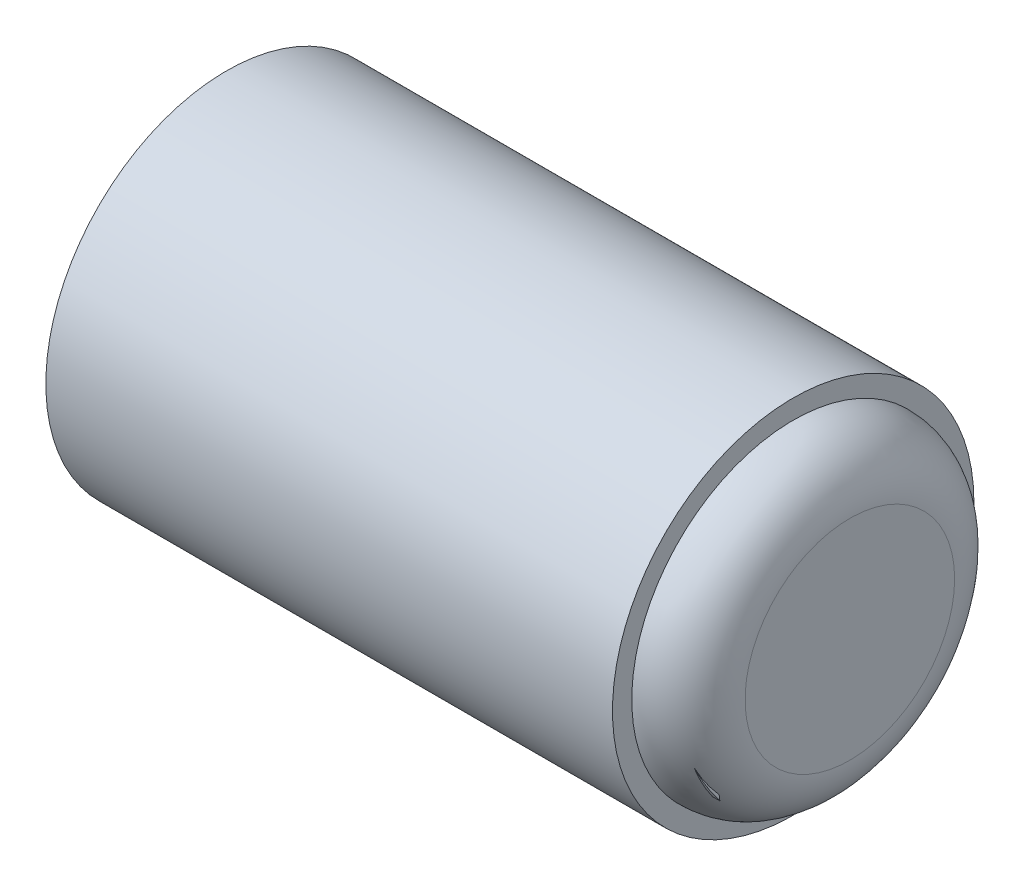
from build123d import *

# Parameters (mm, degrees)
SKETCH2_R           = 3.189369039
SKETCH2_R_2         = 2.589261351
BOSS_EXTRUDE1_DEPTH = 10
SKETCH3_R           = 2.849023425
BOSS_EXTRUDE2_DEPTH = 1
FILLET1_R           = 1
SWEEP1_PITCH        = 3


with BuildPart() as part:
    # Sketch2 → Boss-Extrude1 (new body)
    with BuildSketch(Plane(origin=(0, 0, 0), x_dir=(0, 0, -1), z_dir=(1, 0, 0))):
        Circle(SKETCH2_R)
        Circle(SKETCH2_R_2, mode=Mode.SUBTRACT)
    extrude(amount=BOSS_EXTRUDE1_DEPTH)

    # Sketch3 → Boss-Extrude2 (add)
    with BuildSketch(Plane(origin=(10, 0, 0), x_dir=(0, 0, -1), z_dir=(1, 0, 0))):
        Circle(SKETCH3_R)
    extrude(amount=BOSS_EXTRUDE2_DEPTH)

    # Fillet1
    fillet1_edges = [part.edges().sort_by_distance(p)[0] for p in [
        (11, 0, 2.849023425),
    ]]
    fillet(fillet1_edges, radius=FILLET1_R - 0.0001)  # a hair under: the kernel refuses the full size

    # Sweep1: the profile of Sketch7 profile screwed along a right-hand helix of 3.1 turns, 10 arcs to a turn; built about Z, then put on its axis
    sweep1_z = Axis((0, 0, 0), (0, 0, 1))
    sweep1_corners = [(2.589561351, 0, -0.0003), (2.589561351, 0, 1.5003), (2.289261351, 0, 1.2), (2.289261351, 0, 0.3)]
    with BuildLine(mode=Mode.PRIVATE) as sweep1_profile:
        Line(sweep1_corners[0], sweep1_corners[1])
        Line(sweep1_corners[1], sweep1_corners[2])
        Line(sweep1_corners[2], sweep1_corners[3])
        Line(sweep1_corners[3], sweep1_corners[0])
    sweep1_cap = Face(sweep1_profile.wire())
    sweep1_turn_angles = [0, 18, 36, 54, 72, 90, 108, 126, 144, 162, 180, 198, 216, 234, 252, 270, 288, 306, 324, 342, 360]
    sweep1_turn_weights = [1, 0.9510565162951535, 1, 0.9510565162951535, 1, 0.9510565162951535, 1, 0.9510565162951535, 1, 0.9510565162951535, 1, 0.9510565162951535, 1, 0.9510565162951535, 1, 0.9510565162951535, 1, 0.9510565162951535, 1, 0.9510565162951535, 1]
    sweep1_turn_rails = [Edge.make_bspline([Vector(p[0], p[1], 0).rotate(sweep1_z, sweep1_turn_angles[k]) / sweep1_turn_weights[k] + Vector(0, 0, p[2] + SWEEP1_PITCH * sweep1_turn_angles[k] / 360) for k in range(21)], [0, 0, 0, 1, 1, 2, 2, 3, 3, 4, 4, 5, 5, 6, 6, 7, 7, 8, 8, 9, 9, 10, 10, 10], 2, sweep1_turn_weights) for p in sweep1_corners]
    sweep1_turn_sides = [Face.make_surface_from_curves(sweep1_turn_rails[p[0]], sweep1_turn_rails[p[1]]) for p in [(0, 1), (1, 2), (2, 3), (3, 0)]]
    sweep1_last_angles = [1080, 1098, 1116]
    sweep1_last_weights = [1, 0.9510565162951499, 1]
    sweep1_last_rails = [Edge.make_bspline([Vector(p[0], p[1], 0).rotate(sweep1_z, sweep1_last_angles[k]) / sweep1_last_weights[k] + Vector(0, 0, p[2] + SWEEP1_PITCH * sweep1_last_angles[k] / 360) for k in range(3)], [0, 0, 0, 1, 1, 1], 2, sweep1_last_weights) for p in sweep1_corners]
    sweep1_last_sides = [Face.make_surface_from_curves(sweep1_last_rails[p[0]], sweep1_last_rails[p[1]]) for p in [(0, 1), (1, 2), (2, 3), (3, 0)]]
    sweep1 = Plane(origin=(0, 0, 0), x_dir=(0, 0, 1), z_dir=(1, 0, 0)) * Solid(Shell([*[p.moved(Location((0, 0, SWEEP1_PITCH * i))) for i in range(3) for p in sweep1_turn_sides], *sweep1_last_sides, sweep1_cap, sweep1_cap.rotate(sweep1_z, 1116).moved(Location((0, 0, SWEEP1_PITCH * 1116 / 360)))]))
    add(sweep1)


solid = part.part
